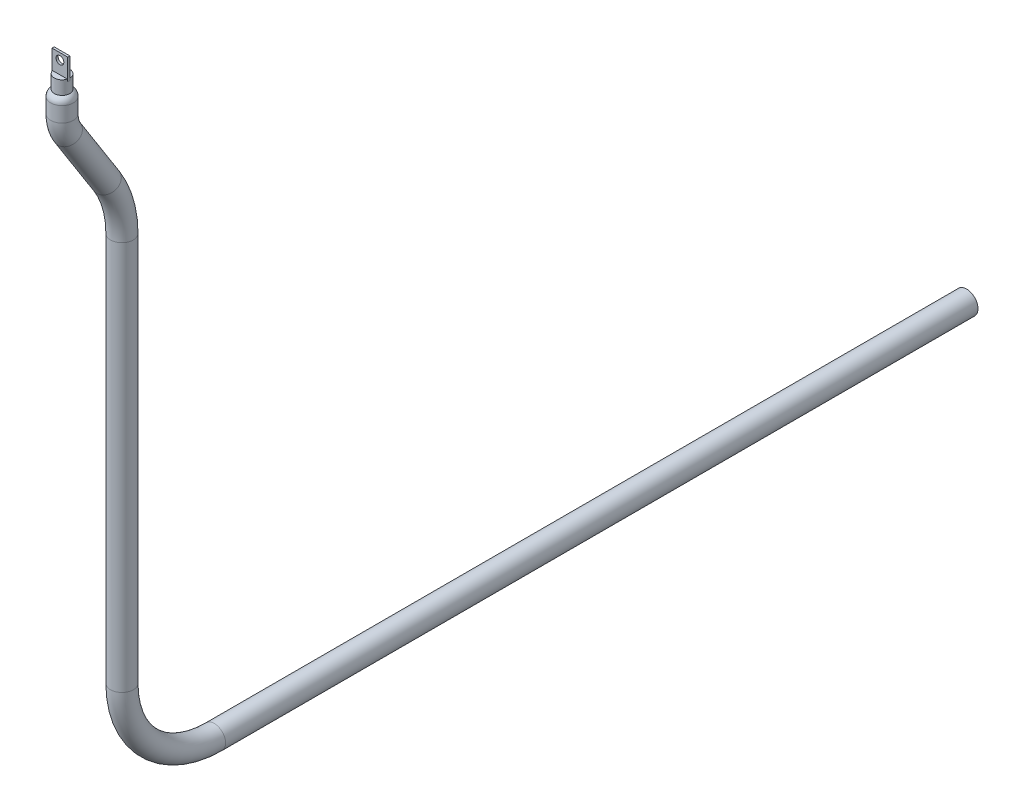
from build123d import *

# Parameters (mm, degrees)
BARRER1_PROFILE_R       = 16
CROQUIS14_W             = 22
CROQUIS14_H             = 30
CROQUIS14_R             = 5.5
SALIENTE_EXTRUIR1_DEPTH = 3
CROQUIS15_R             = 10.841108792
SALIENTE_EXTRUIR2_DEPTH = 19
REDONDEO1_R             = 10


with BuildPart() as part:
    # Barrer1: sweep along a curve in space
    with BuildLine() as barrer1_path:
        Line((-975.305963879, -247.418485436, 3234.31), (-975.305963879, -277.482733156, 3234.31))
        ThreePointArc((-975.305963879, -277.482733156, 3234.31), (-975.305963879, -291.434368594, 3232.3240799), (-975.305963879, -304.277730703, 3226.524074744))
        Line((-975.305963879, -304.277730703, 3226.524074744), (-975.305963879, -390.490454439, 3171.801337481))
        ThreePointArc((-975.305963879, -390.490454439, 3171.801337481), (-975.305963879, -426.451868342, 3155.561323045), (-975.305963879, -465.51644757, 3150.000746764))
        Line((-975.305963879, -465.51644757, 3150.000746764), (-975.305963879, -1014.035511618, 3150.000746764))
        ThreePointArc((-975.305963879, -1144.035511618, 3020.000746764), (-975.305963879, -1105.959393172, 3111.924628318), (-975.305963879, -1014.035511618, 3150.000746764))
        Line((-975.305963879, -1144.035511618, 3020.000746764), (-975.305963879, -1144.035511618, 1960.497178493))
    # Barrer1 profile (on start of the path) → Barrer1 (sweep)
    with BuildSketch(Plane(origin=(-975.305963879, -247.418485436, 3234.31), x_dir=(0, 0, -1), z_dir=(0, -1, 0))):
        Circle(BARRER1_PROFILE_R)
    sweep(path=barrer1_path.line)



with BuildPart() as body_2:
    # Croquis14 → Saliente-Extruir1 (new body)
    with BuildSketch(Plane.XY.offset(3234.31)):
        with Locations((-975.305963879, -216.330473188)):
            Rectangle(CROQUIS14_W, CROQUIS14_H)
        with Locations((-975.305963879, -210.525068536)):
            Circle(CROQUIS14_R, mode=Mode.SUBTRACT)
    extrude(amount=SALIENTE_EXTRUIR1_DEPTH)


with BuildPart() as part_1:
    add(part.part)

    add(body_2.part)  # Saliente-Extruir2 merges body 2
    # Croquis15 → Saliente-Extruir2 (add)
    with BuildSketch(Plane(origin=(0, -247.418485436, 0), x_dir=(1, 0, 0), z_dir=(0, 1, 0))):
        with Locations(Location((-975.305963879, -3234.31, 0), (0, 0, 180))):
            Circle(CROQUIS15_R)
    extrude(amount=SALIENTE_EXTRUIR2_DEPTH)

    # Redondeo1
    # the kernel refuses this fillet: 10 mm, written as the material it takes off along each edge
    with BuildSketch(Plane(origin=(-975.305963879, -247.418485436, 3234.31), x_dir=(0, 0, -1), z_dir=(-1, 0, 0))) as redondeo1_piece_1:
        with BuildLine():
            CenterArc((6, 8.75006661), REDONDEO1_R, 298.954236043, 61.045763957)
            Line((10.841108792, 0), (10.937930967, -0.175001332))
            ThreePointArc((10.937930967, -0.175001332), (13.420554396, -0.2), (16, -0.2))
            Line((16, -0.2), (16.2, 0))
            Line((16.2, 0), (16.2, 8.75006661))
            Line((16.2, 8.75006661), (16, 8.75006661))
        make_face()
    revolve(axis=Axis((-975.305963879, -247.418485436, 3234.31), (0, -1, 0)), mode=Mode.SUBTRACT)


solid = part_1.part
